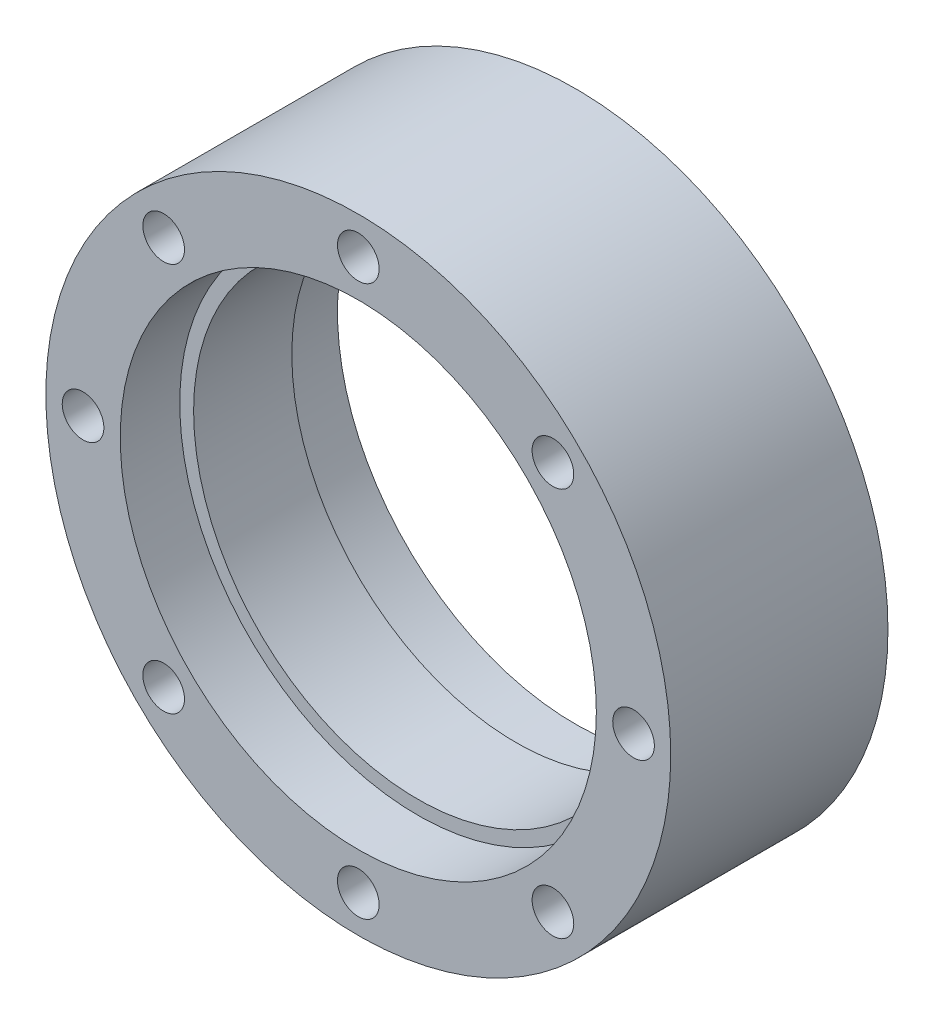
from build123d import *

# Parameters (mm, degrees)
SKETCH3_R          = 1.4
CUT_EXTRUDE2_DEPTH = 31.582511342
CUT_EXTRUDE4_START = -2.5
SKETCH4_R          = 2.35
CUT_EXTRUDE4_DEPTH = 36.593201719
CHAMFER1_SIZE      = 0.1
CIRPATTERN3_COUNT  = 4
CIRPATTERN2_COUNT  = 8


with BuildPart() as part:
    # Sketch7 → Revolve1 (revolve)
    with BuildSketch(Plane(origin=(0, 0, 0), x_dir=(1, 0, 0), z_dir=(0, 1, 0))):
        Polygon((16, 7.3), (16, 3.3), (15.07, 3.3), (15.07, -3.3), (16, -3.3), (16, -7.3), (21, -7.3), (21, 7.3), align=None)
    revolve(axis=Axis((0, 0, 8.03), (0, 0, -1)))

    # Sketch3 → Cut-Extrude2 (cut, symmetric)
    with BuildSketch(Plane.XY):
        with Locations((0, 18.5)):
            Circle(SKETCH3_R)
    cut_extrude2 = extrude(amount=CUT_EXTRUDE2_DEPTH, both=True, mode=Mode.SUBTRACT)

    # Sketch4 → Cut-Extrude4 (cut)
    with BuildSketch(Plane(origin=(0, 0, -7.3), x_dir=(-1, 0, 0), z_dir=(0, 0, -1)).offset(CUT_EXTRUDE4_START)):
        with Locations((0, 18.5)):
            Circle(SKETCH4_R)
    cut_extrude4 = extrude(amount=CUT_EXTRUDE4_DEPTH, mode=Mode.SUBTRACT)

    # Chamfer1
    chamfer1_edges = [part.edges().sort_by_distance(p)[0] for p in [
        (-1.4, 18.5, -4.8),
    ]]
    chamfer(chamfer1_edges, length=CHAMFER1_SIZE)

    # CirPattern3: Cut-Extrude4 ×4 about axis
    cirpattern3_axis = Axis((0, 0, 8.03), (0, 0, -1))
    for i in range(1, CIRPATTERN3_COUNT):
        add(cut_extrude4.rotate(cirpattern3_axis, i * 360 / CIRPATTERN3_COUNT), mode=Mode.SUBTRACT)

    # CirPattern2: Cut-Extrude2 ×8 about axis
    cirpattern2_axis = Axis((0, 0, 8.03), (0, 0, -1))
    for i in range(1, CIRPATTERN2_COUNT):
        add(cut_extrude2.rotate(cirpattern2_axis, i * 360 / CIRPATTERN2_COUNT), mode=Mode.SUBTRACT)


solid = part.part
